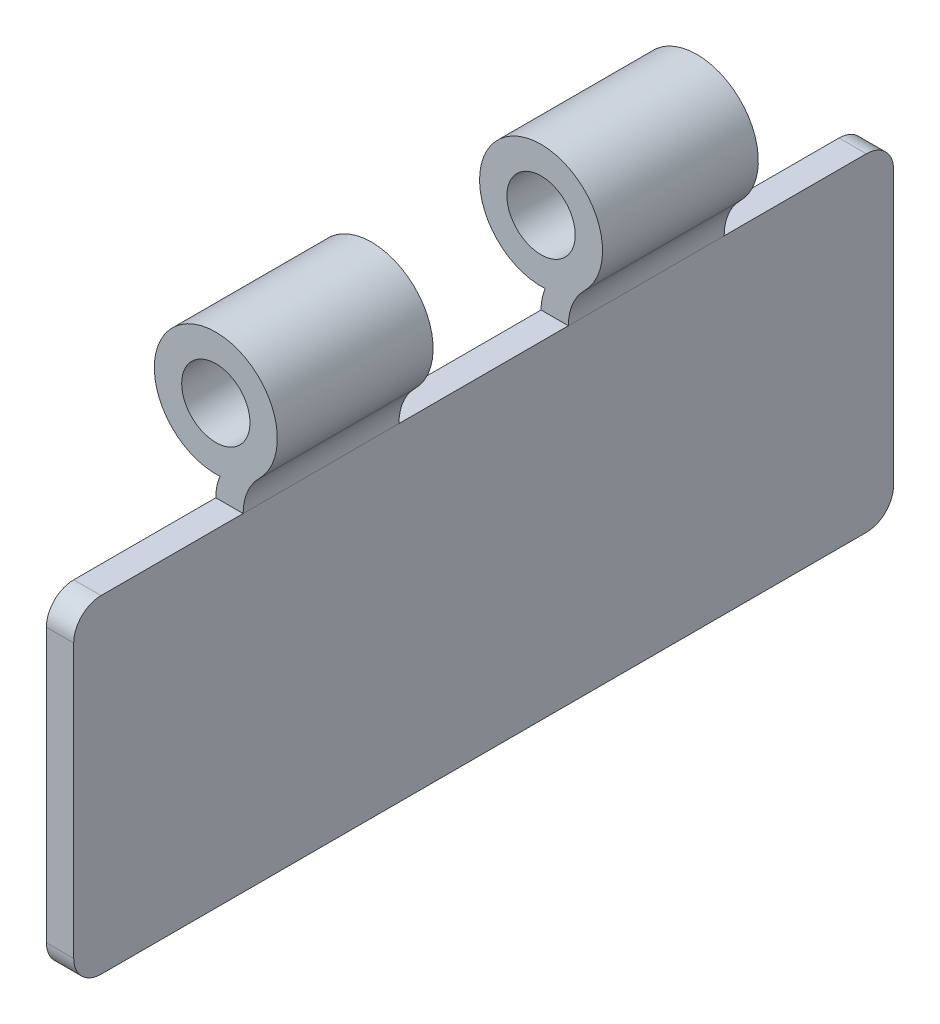
from build123d import *

# Parameters (mm, degrees)
SKETCH1_R           = 3.175
BOSS_EXTRUDE1_DEPTH = 38.1
SKETCH1_3_R         = 3.175
CUT_EXTRUDE1_DEPTH  = 7.874
SKETCH2_R           = 3.175
CUT_EXTRUDE2_DEPTH  = 15.748
FILLET1_R           = 2.54


with BuildPart() as part:
    # Sketch1 → Boss-Extrude1 (new, symmetric)
    with BuildSketch(Plane.XY):
        with BuildLine():
            Line((0, 0), (2.54, 0))
            Line((2.54, 0), (2.54, 30.48))
            ThreePointArc((2.54, 30.48), (2.925884615, 32.409423077), (4.024171598, 34.042011834))
            ThreePointArc((4.024171598, 34.042011834), (-2.351034724, 43.309017251), (0.381023909, 32.39771574))
            ThreePointArc((0.381023909, 32.39771574), (0.096177955, 31.457600747), (0, 30.48))
            Line((0, 30.48), (0, 0))
        make_face()
        with Locations((0, 38.1)):
            Circle(SKETCH1_R, mode=Mode.SUBTRACT)
    extrude(amount=BOSS_EXTRUDE1_DEPTH, both=True)

    # Sketch1<3> → Cut-Extrude1 (cut, symmetric)
    with BuildSketch(Plane.XY):
        with BuildLine():
            Line((0, 30.48), (2.54, 30.48))
            ThreePointArc((2.54, 30.48), (2.925884615, 32.409423077), (4.024171598, 34.042011834))
            ThreePointArc((4.024171598, 34.042011834), (-2.351034724, 43.309017251), (0.381023909, 32.39771574))
            ThreePointArc((0.381023909, 32.39771574), (0.096177955, 31.457600747), (0, 30.48))
        make_face()
        with Locations((0, 38.1)):
            Circle(SKETCH1_3_R, mode=Mode.SUBTRACT)
    extrude(amount=CUT_EXTRUDE1_DEPTH, both=True, mode=Mode.SUBTRACT)

    # Sketch2 → Cut-Extrude2 (cut)
    with BuildSketch(Plane.XY.offset(38.1)):
        with BuildLine():
            Line((2.54, 30.48), (0, 30.48))
            ThreePointArc((0, 30.48), (0.096177955, 31.457600747), (0.381023909, 32.39771574))
            ThreePointArc((0.381023909, 32.39771574), (-2.351034724, 43.309017251), (4.024171598, 34.042011834))
            ThreePointArc((4.024171598, 34.042011834), (2.925884615, 32.409423077), (2.54, 30.48))
        make_face()
        with Locations((0, 38.1)):
            Circle(SKETCH2_R, mode=Mode.SUBTRACT)
    cut_extrude2 = extrude(amount=-CUT_EXTRUDE2_DEPTH, mode=Mode.SUBTRACT)

    # Mirror1: Cut-Extrude2 across plane
    add(cut_extrude2.mirror(Plane.XY), mode=Mode.SUBTRACT)

    # Fillet1
    fillet1_edges = [part.edges().sort_by_distance(p)[0] for p in [
        (1.27, 0, 38.1),
        (1.27, 30.48, 38.1),
        (1.27, 0, -38.1),
        (1.27, 30.48, -38.1),
    ]]
    fillet(fillet1_edges, radius=FILLET1_R)


solid = part.part
